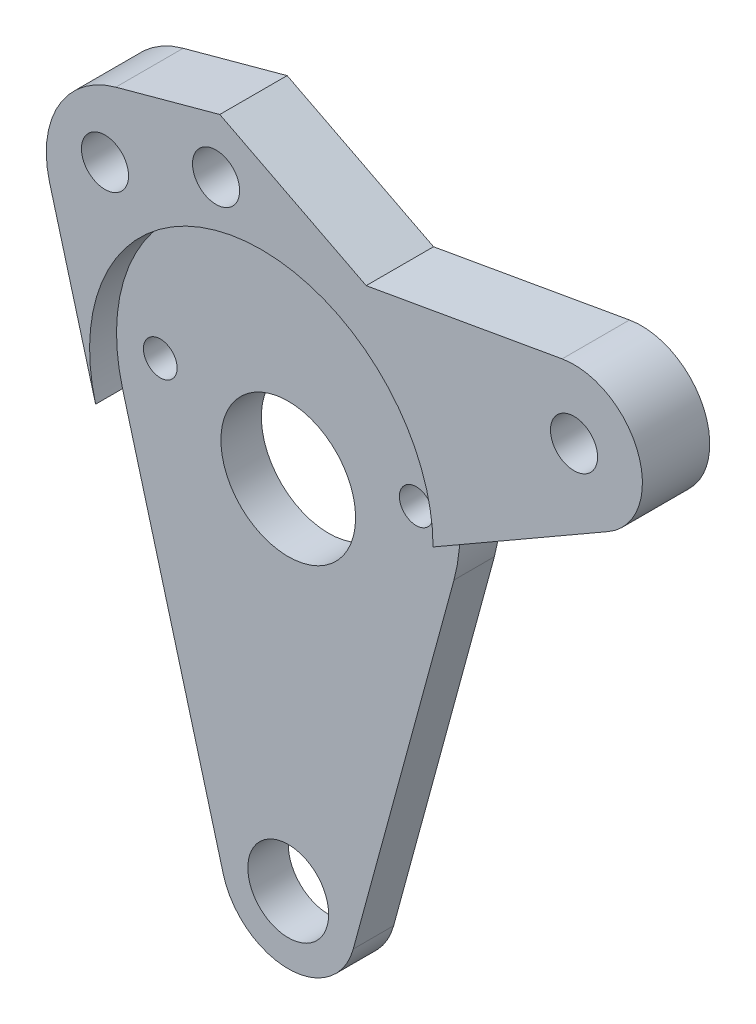
from build123d import *

# Parameters (mm, degrees)
SKETCH1_R           = 3
SKETCH1_R_2         = 5
SKETCH1_R_3         = 1.25
BOSS_EXTRUDE1_DEPTH = 3
SKETCH2_R           = 1.75
BOSS_EXTRUDE2_DEPTH = 5
SKETCH4_R           = 1.75
BOSS_EXTRUDE3_DEPTH = 5


with BuildPart() as part:
    # Sketch1 → Boss-Extrude1 (new body)
    with BuildSketch(Plane.XY):
        with BuildLine():
            Line((-4.824371659, -30.813559322), (-12.302147731, -3.349576271))
            ThreePointArc((-12.302147731, -3.349576271), (0, 12.75), (12.302147731, -3.349576271))
            Line((12.302147731, -3.349576271), (4.824371659, -30.813559322))
            ThreePointArc((4.824371659, -30.813559322), (0, -34.5), (-4.824371659, -30.813559322))
        make_face()
        with Locations((0, -29.5)):
            Circle(SKETCH1_R, mode=Mode.SUBTRACT)
        with Locations((0, -3)):
            Circle(SKETCH1_R_2, mode=Mode.SUBTRACT)
        with Locations((-9.5, 0)):
            Circle(SKETCH1_R_3, mode=Mode.SUBTRACT)
        with Locations((9.5, 0)):
            Circle(SKETCH1_R_3, mode=Mode.SUBTRACT)
    extrude(amount=BOSS_EXTRUDE1_DEPTH)

    # Sketch2 → Boss-Extrude2 (add)
    with BuildSketch(Plane.XY):
        with BuildLine():
            Line((-2.214014265, 12.556298851), (22.333416551, 16.884673211))
            ThreePointArc((22.333416551, 16.884673211), (27.986397612, 13.618876906), (25.748516278, 7.485891702))
            Line((25.748516278, 7.485891702), (12.75, 0))
            ThreePointArc((12.75, 0), (8.195542024, 9.76706665), (-2.214014265, 12.556298851))
        make_face()
        with Locations((23.214967202, 11.885151032)):
            Circle(SKETCH2_R, mode=Mode.SUBTRACT)
    extrude(amount=BOSS_EXTRUDE2_DEPTH)

    # Sketch4 → Boss-Extrude3 (add)
    with BuildSketch(Plane.XY):
        with BuildLine():
            Line((-12.302147731, -3.349576271), (-15.717401969, 9.193790043))
            ThreePointArc((-15.717401969, 9.193790043), (-15.039523313, 14.50829999), (-10.802264696, 17.786893417))
            Line((-10.802264696, 17.786893417), (-3.083270041, 19.888588332))
            Line((-3.083270041, 19.888588332), (7.785985735, 14.319568658))
            Line((7.785985735, 14.319568658), (-2.214014265, 12.556298851))
            ThreePointArc((-2.214014265, 12.556298851), (-10.767030957, 6.828875777), (-12.302147731, -3.349576271))
        make_face()
        with Locations((-11.605794134, 12.556298851)):
            Circle(SKETCH4_R, mode=Mode.SUBTRACT)
        with Locations((-3.35955608, 15.717192621)):
            Circle(SKETCH4_R, mode=Mode.SUBTRACT)
    extrude(amount=BOSS_EXTRUDE3_DEPTH)


solid = part.part
